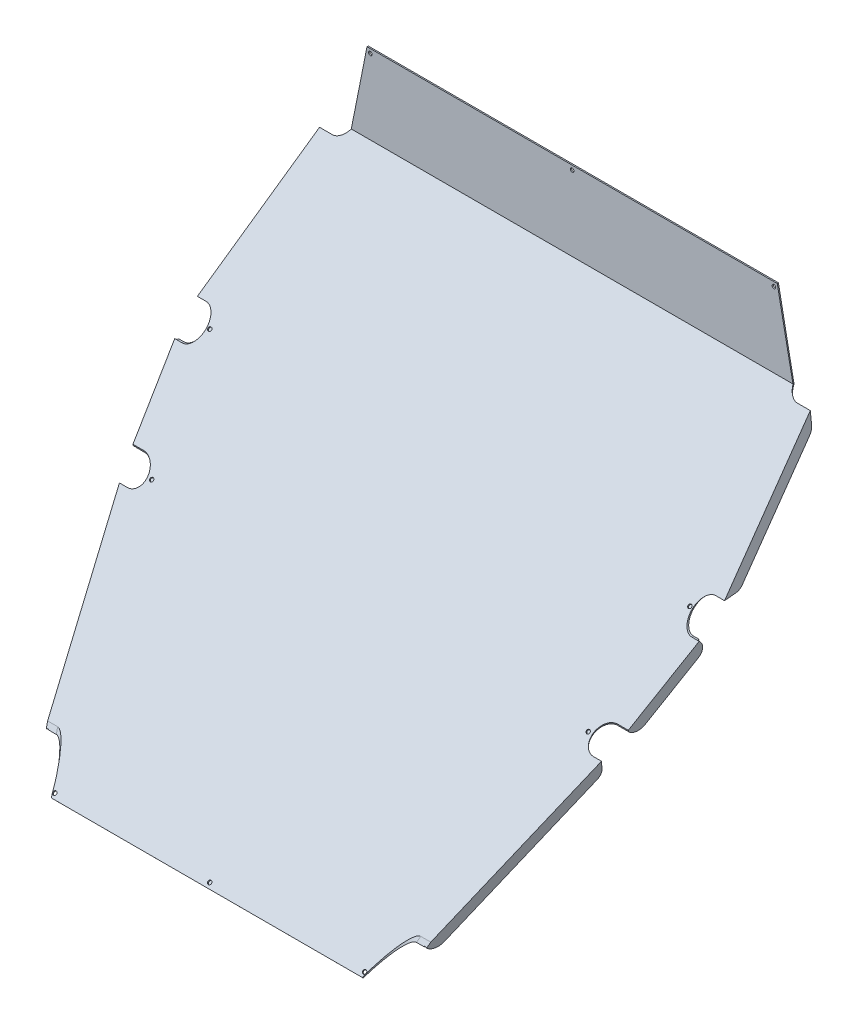
from build123d import *
from build123d.topology import SkipClean

# Parameters (mm, degrees)
UPPER_DEPTH         = 1.5
LOWER_DEPTH         = 1.5
BOSS_EXTRUDE1_DEPTH = 12.7
SKETCH3_R           = 2.159
CUT_EXTRUDE3_DEPTH  = 25.4
SKETCH21_R          = 14.2875
CUT_EXTRUDE28_DEPTH = 874.615346647
SKETCH8_R           = 12.7
CUT_EXTRUDE9_DEPTH  = 909.841508723
SKETCH7_R           = 14.2875
CUT_EXTRUDE10_DEPTH = 768.787550437
SKETCH6_R           = 14.2875
CUT_EXTRUDE11_DEPTH = 805.372191991
CUT_EXTRUDE13_DEPTH = 5.08
CUT_EXTRUDE16_DEPTH = 2.54
CUT_EXTRUDE22_DEPTH = 2.54
SKETCH20_R          = 2.159
CUT_EXTRUDE25_DEPTH = 5.08
SKETCH19_R          = 2.159
CUT_EXTRUDE26_DEPTH = 5.08
SKETCH18_R          = 2.159
CUT_EXTRUDE27_DEPTH = 5.08
SKETCH23_R          = 2.159
CUT_EXTRUDE29_DEPTH = 755.225962057
SKETCH24_W          = 4.7625
SKETCH24_H          = 406.4
BOSS_EXTRUDE2_DEPTH = 19.05


# Read off the part's stored shape, not the designer's step: Mirror1
with BuildPart() as part:
    # Sketch1 → Upper (new body)
    with BuildSketch(Plane.XY):
        Polygon((-268.322950018, 0), (268.322950018, 0), (291.817849942, -95.25), (-291.817849942, -95.25), align=None)
    extrude(amount=UPPER_DEPTH)

    # Sketch2 → Lower (add)
    with BuildSketch(Plane(origin=(0, -47.82449055, -47.624582187), x_dir=(1, 0, 0), z_dir=(0, 0.7085861902250874, 0.7056242704317195))):
        Polygon((-292.843249974, -408.979811759), (-213.216599982, -684.467611759), (-211.306786287, -681.927611759), (-290.367685881, -408.397163128), (-314.93135919, -274.122656346), (-289.573528128, -69.750711759), (-291.817849942, -67.210711759), (-317.5, -274.196511759), align=None)
        Polygon((-213.216599982, -684.467611759), (-211.306786287, -681.927611759), (-290.367685881, -408.397163128), (-314.93135919, -274.122656346), (-289.573528128, -69.750711759), (-291.817849942, -67.210711759), (291.817849942, -67.210711759), (289.573528128, -69.750711759), (314.93135919, -274.122656346), (290.367685881, -408.397163128), (211.306786287, -681.927611759), (213.216599982, -684.467611759), align=None)
        Polygon((213.216599982, -684.467611759), (211.306786287, -681.927611759), (290.367685881, -408.397163128), (314.93135919, -274.122656346), (289.573528128, -69.750711759), (291.817849942, -67.210711759), (317.5, -274.196511759), (292.843249974, -408.979811759), align=None)
    extrude(amount=LOWER_DEPTH)

    # Sketch2<3> → Boss-Extrude1 (add)
    with BuildSketch(Plane(origin=(0, -47.82449055, -47.624582187), x_dir=(1, 0, 0), z_dir=(0, 0.7085861902250874, 0.7056242704317195))):
        Polygon((213.216599982, -684.467611759), (211.306786287, -681.927611759), (290.367685881, -408.397163128), (314.93135919, -274.122656346), (289.573528128, -69.750711759), (291.817849942, -67.210711759), (317.5, -274.196511759), (292.843249974, -408.979811759), align=None)
    extrude(amount=-BOSS_EXTRUDE1_DEPTH)

    # Sketch3 → Cut-Extrude3 (cut)
    with BuildSketch(Plane(origin=(0, 0, 0), x_dir=(-1, 0, 0), z_dir=(0, 0, -1))):
        with Locations((-241.3, -5.08)):
            Circle(SKETCH3_R)
        with Locations((0, -5.08)):
            Circle(SKETCH3_R)
        with Locations((241.3, -5.08)):
            Circle(SKETCH3_R)
    extrude(amount=-CUT_EXTRUDE3_DEPTH, mode=Mode.SUBTRACT)

    # Sketch21 → Cut-Extrude28 (cut, through all)
    with BuildSketch(Plane(origin=(196.85, -539.746170446, 446.36474374), x_dir=(-0.9557127001633002, 0.25055659462572005, -0.15438467422686922), z_dir=(-0.29430126528197925, -0.8136564393089987, 0.5013481465253741))):
        with BuildLine():
            ThreePointArc((0, -14.2875), (-14.2875, 0), (0, 14.2875))
            Line((0, 14.2875), (-38.1, 14.2875))
            Line((-38.1, 14.2875), (-38.1, -14.2875))
            Line((-38.1, -14.2875), (0, -14.2875))
        make_face()
        Circle(SKETCH21_R)
    extrude(amount=-CUT_EXTRUDE28_DEPTH, mode=Mode.SUBTRACT)

    # Sketch8 → Cut-Extrude9 (cut, through all)
    with BuildSketch(Plane(origin=(255.6256, 12.775047317, 0.0545235), x_dir=(0.9817895969366798, 0.189921913110119, 0.004342150101546657), z_dir=(-0.18997154351879111, 0.9815331026321988, 0.022440612520550327))):
        Circle(SKETCH8_R)
        with BuildLine():
            ThreePointArc((12.7, 0), (8.980256121, -8.980256121), (0, -12.7))
            Line((0, -12.7), (50.8, -12.7))
            Line((50.8, -12.7), (50.8, 12.7))
            Line((50.8, 12.7), (0, 12.7))
            ThreePointArc((0, 12.7), (8.980256121, 8.980256121), (12.7, 0))
        make_face()
    extrude(amount=-CUT_EXTRUDE9_DEPTH, mode=Mode.SUBTRACT)

    # Sketch7 → Cut-Extrude10 (cut, symmetric)
    with BuildSketch(Plane(origin=(0, 0, -5.754260468), x_dir=(-1, 0, 0), z_dir=(0, 0, -1))):
        with Locations((-304.8, -241.296170446)):
            Circle(SKETCH7_R)
        with BuildLine():
            Line((-355.6, -255.583670446), (-304.8, -255.583670446))
            ThreePointArc((-304.8, -255.583670446), (-319.0875, -241.296170446), (-304.8, -227.008670446))
            Line((-304.8, -227.008670446), (-355.6, -227.008670446))
            Line((-355.6, -227.008670446), (-355.6, -255.583670446))
        make_face()
    extrude(amount=CUT_EXTRUDE10_DEPTH, both=True, mode=Mode.SUBTRACT)

    # Sketch6 → Cut-Extrude11 (cut, through all)
    with BuildSketch(Plane(origin=(228.6, -539.746170446, 198.722727079), x_dir=(0.9702139044987836, -0.23690600809094062, -0.050601609140820056), z_dir=(0.2422498287248624, 0.948811829172378, 0.202660142369784))):
        Circle(SKETCH6_R)
        with BuildLine():
            ThreePointArc((14.2875, 0), (10.102788136, -10.102788136), (0, -14.2875))
            Line((0, -14.2875), (50.8, -14.2875))
            Line((50.8, -14.2875), (50.8, 14.2875))
            Line((50.8, 14.2875), (0, 14.2875))
            ThreePointArc((0, 14.2875), (10.102788136, 10.102788136), (14.2875, 0))
        make_face()
    extrude(amount=CUT_EXTRUDE11_DEPTH, mode=Mode.SUBTRACT)

    # Sketch12 → Cut-Extrude13 (cut)
    with BuildSketch(Plane(origin=(279.180551252, 24.44271802, -24.545318473), x_dir=(-0.0869176220205297, -0.007609781256081438, -0.9961864374762041), z_dir=(0.9923902182248356, 0.08688540143887281, -0.0872501105355694))):
        with BuildLine():
            ThreePointArc((-34.458545921, -142.642226363), (-35.363095323, -147.648027336), (-38.159492817, -151.897311282))
            Line((-38.159492817, -151.897311282), (-34.334674949, -148.059274691))
            Line((-34.334674949, -148.059274691), (-34.458545921, -142.642226363))
        make_face()
        with BuildLine():
            ThreePointArc((-135.708080175, -249.783030443), (-139.788854201, -252.528666144), (-144.606803116, -253.517908429))
            Line((-144.606803116, -253.517908429), (-139.390384316, -253.478060774))
            Line((-139.390384316, -253.478060774), (-135.708080175, -249.783030443))
        make_face()
        Polygon((-34.458545921, -142.642226363), (-34.334674949, -148.059274691), (-33.456000975, -142.287544019), align=None)
    extrude(amount=-CUT_EXTRUDE13_DEPTH, mode=Mode.SUBTRACT)


with BuildPart() as body_2:
    # of the pieces the cut leaves, the one that is kept (cut_extrude13_keep)
    add(part.part.solids().sort_by_distance((-268.322950018, 0, 0))[0])

    # Sketch9 → Cut-Extrude16 (cut)
    with BuildSketch(Plane(origin=(379.361144518, -77.371751981, 77.696526699), x_dir=(0.19278613597149513, -0.03931926427703094, -0.9804527021911323), z_dir=(0.9606757859804161, -0.19593247679954207, 0.19675492056390054))):
        with BuildLine():
            Line((-176.807332276, -298.778278327), (-178.232267114, -292.159968301))
            ThreePointArc((-178.232267114, -292.159968301), (-178.434275143, -298.314516716), (-181.507674694, -303.650572247))
            Line((-181.507674694, -303.650572247), (-176.807332276, -298.778278327))
        make_face()
        with BuildLine():
            Line((-331.617972049, -441.042646452), (-332.474146327, -440.216866681))
            Line((-332.474146327, -440.216866681), (-322.519098896, -449.820583633))
            Line((-322.519098896, -449.820583633), (-313.701575889, -440.680491291))
            ThreePointArc((-313.701575889, -440.680491291), (-322.58500773, -444.56037453), (-331.617972049, -441.042646452))
        make_face()
        Polygon((-322.519098896, -449.820583633), (-332.474146327, -440.216866681), (-335.674588136, -441.430740469), (-359.267836197, -484.804221539), (-357.714104356, -486.303119554), align=None)
    extrude(amount=-CUT_EXTRUDE16_DEPTH, mode=Mode.SUBTRACT)

    # Sketch10 → Cut-Extrude22 (cut)
    with BuildSketch(Plane(origin=(355.754903335, -45.922355027, 46.115118142), x_dir=(0.12646080723028635, -0.01632409850759065, -0.9918372790143446), z_dir=(0.9836757682395201, -0.12697704918987876, 0.12751004649603565))):
        with BuildLine():
            ThreePointArc((-116.91323791, -214.396901236), (-113.138471271, -223.354168193), (-116.803052388, -232.357075488))
            Line((-116.803052388, -232.357075488), (-97.690742096, -213.008809877))
            Line((-97.690742096, -213.008809877), (-117.980385141, -213.342768044))
            Line((-117.980385141, -213.342768044), (-116.91323791, -214.396901236))
        make_face()
        with BuildLine():
            ThreePointArc((-167.632633505, -283.814184614), (-176.500013499, -287.588081665), (-185.464014694, -284.04980391))
            Line((-185.464014694, -284.04980391), (-182.326299222, -298.68925428))
            Line((-182.326299222, -298.68925428), (-167.632633505, -283.814184614))
        make_face()
        with BuildLine():
            ThreePointArc((-185.464014694, -284.04980391), (-185.528633184, -283.987314925), (-185.592807757, -283.924370136))
            Line((-185.592807757, -283.924370136), (-185.898455633, -283.622449687))
            Line((-185.898455633, -283.622449687), (-186.418418258, -302.057831208))
            Line((-186.418418258, -302.057831208), (-176.55762787, -302.057831208))
            Line((-176.55762787, -302.057831208), (-167.632633505, -283.814184614))
            Line((-167.632633505, -283.814184614), (-182.326299222, -298.68925428))
            Line((-182.326299222, -298.68925428), (-185.464014694, -284.04980391))
        make_face()
    extrude(amount=-CUT_EXTRUDE22_DEPTH, mode=Mode.SUBTRACT)

    # Mirror1
    split(bisect_by=Plane(origin=(0, 0, 0), x_dir=(0, 0, 1), z_dir=(1, 0, 0)), keep=Keep.TOP)

    # Mirror1 2: body 2 across plane


with BuildPart() as body_2_1:
    with SkipClean():  # the faces are left unmerged after this step: merging them gives an invalid solid
        add(body_2.part)
        add(body_2.part.mirror(Plane(origin=(0, 0, 0), x_dir=(0, 0, 1), z_dir=(1, 0, 0))))

    # Sketch20 → Cut-Extrude25 (cut)
    with SkipClean():  # the faces are left unmerged after this step: merging them gives an invalid solid
        with BuildSketch(Plane(origin=(0, -47.82557375, -47.624577646), x_dir=(1, 0, 0), z_dir=(1.6140263867400147e-15, 0.7085942146752751, 0.7056162122065581))):
            with Locations(Location((0, -679.386829065, 0), (0, 0, 269.999999992))):
                Circle(SKETCH20_R)
        cut_extrude25 = extrude(amount=CUT_EXTRUDE25_DEPTH, mode=Mode.SUBTRACT)

    # Sketch19 → Cut-Extrude26 (cut)
    with SkipClean():  # the faces are left unmerged after this step: merging them gives an invalid solid
        with BuildSketch(Plane(origin=(0, -47.82557375, -47.624577646), x_dir=(1, 0, 0), z_dir=(1.6417819623556435e-15, 0.7085942146752751, 0.7056162122065581))):
            with Locations(Location((-260.942318198, -408.979044635, 0), (0, 0, 269.999999991))):
                Circle(SKETCH19_R)
        cut_extrude26 = extrude(amount=CUT_EXTRUDE26_DEPTH, mode=Mode.SUBTRACT)

    # Sketch18 → Cut-Extrude27 (cut)
    with SkipClean():  # the faces are left unmerged after this step: merging them gives an invalid solid
        with BuildSketch(Plane(origin=(0, -47.82557375, -47.624577646), x_dir=(1, 0, 0), z_dir=(1.6972931135869015e-15, 0.7085942146752751, 0.7056162122065581))):
            with Locations(Location((-287.02, -274.195777815, 0), (0, 0, 269.999999991))):
                Circle(SKETCH18_R)
        cut_extrude27 = extrude(amount=CUT_EXTRUDE27_DEPTH, mode=Mode.SUBTRACT)

    # Sketch23 → Cut-Extrude29 (cut, symmetric)
    with SkipClean():  # the faces are left unmerged after this step: merging them gives an invalid solid
        with BuildSketch(Plane(origin=(0, -47.82557375, -47.624577646), x_dir=(1, 0, 0), z_dir=(1.7528042648181593e-15, 0.708594214675275, 0.7056162122065582))):
            with Locations(Location((-185.162281701, -679.386829065, 0), (0, 0, 269.999999991))):
                Circle(SKETCH23_R)
        cut_extrude29 = extrude(amount=CUT_EXTRUDE29_DEPTH, both=True, mode=Mode.SUBTRACT)

    # Mirror2: Cut-Extrude25, Cut-Extrude26, Cut-Extrude27, Cut-Extrude29 across plane
    with SkipClean():  # the faces are left unmerged after this step: merging them gives an invalid solid
        add(cut_extrude25.mirror(Plane(origin=(0, 0, 0), x_dir=(0, 0, 1), z_dir=(1, 0, 0))), mode=Mode.SUBTRACT)
        add(cut_extrude26.mirror(Plane(origin=(0, 0, 0), x_dir=(0, 0, 1), z_dir=(1, 0, 0))), mode=Mode.SUBTRACT)
        add(cut_extrude27.mirror(Plane(origin=(0, 0, 0), x_dir=(0, 0, 1), z_dir=(1, 0, 0))), mode=Mode.SUBTRACT)
        add(cut_extrude29.mirror(Plane(origin=(0, 0, 0), x_dir=(0, 0, 1), z_dir=(1, 0, 0))), mode=Mode.SUBTRACT)

    # Sketch24 → Boss-Extrude2 (add)
    with SkipClean():  # the faces are left unmerged after this step: merging them gives an invalid solid
        with BuildSketch(Plane(origin=(0, -47.82449055, -47.624582187), x_dir=(1, 0, 0), z_dir=(0, -0.7085861902250873, -0.7056242704317196))):
            with Locations((0, 270.410711759)):
                Rectangle(SKETCH24_W, SKETCH24_H)
        extrude(amount=BOSS_EXTRUDE2_DEPTH)


solid = body_2_1.part
